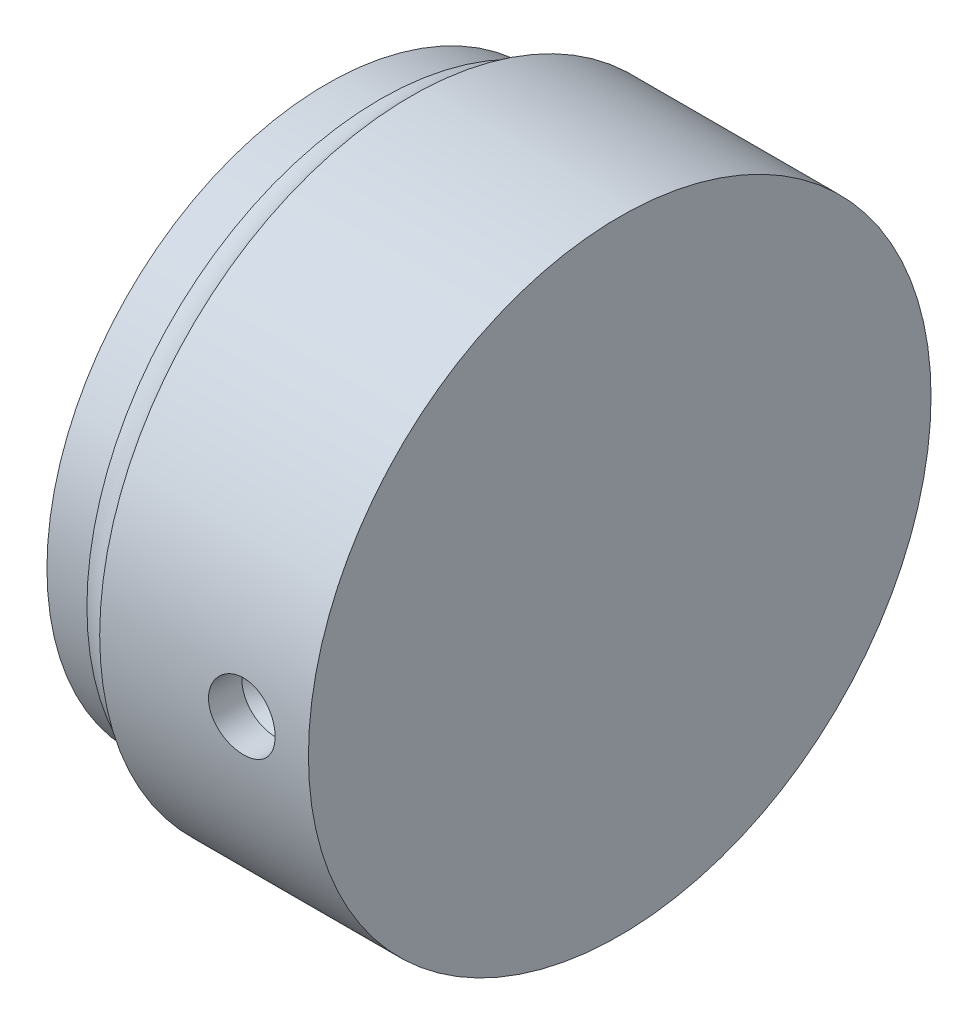
from build123d import *

# Parameters (mm, degrees)
CUT_EXTRUDE8_REACH      = 118.862
CUT_EXTRUDE8_END_RADIUS = 3
SKETCH2_R               = 2.5
SKETCH9_R               = 5
CUT_EXTRUDE9_DEPTH      = 5
CHAMFER1_SIZE           = 2.5


with BuildPart() as part:
    # Sketch1 → Revolve1 (revolve)
    with BuildSketch(Plane.XY, mode=Mode.PRIVATE) as revolve1_sk:
        with BuildLine():
            Line((-28.837765837, -3), (-15.779224455, -3))
            Line((-15.779224455, -3), (-15.779224455, 0))
            Line((-15.779224455, 0), (-8.279224455, 0))
            Line((-8.279224455, 0), (-8.279224455, -46.741129743))
            Line((-8.279224455, -46.741129743), (-39.621237636, -46.741129743))
            ThreePointArc((-39.621237636, -46.741129743), (-41.576881329, -44.736133736), (-44.279224455, -44))
            Line((-44.279224455, -44), (-44.279224455, -42))
            Line((-44.279224455, -42), (-52.279224455, -42))
            Line((-52.279224455, -42), (-52.279224455, -30))
            Line((-52.279224455, -30), (-52.279224455, -24.707456133))
            Line((-52.279224455, -24.707456133), (-50.558495146, -22.25))
            Line((-50.558495146, -22.25), (-50.558495146, -5.457456133))
            Line((-50.558495146, -5.457456133), (-48.837765837, -3))
            Line((-48.837765837, -3), (-28.837765837, -3))
        make_face()
    revolve(revolve1_sk.sketch.rotate(Axis((-82.123840877, 0, 0), (1, 0, 0)), 270), axis=Axis((-82.123840877, 0, 0), (1, 0, 0)))

    # Cut-Extrude8: up to this cylinder (the profile starts outside it)
    cut_extrude8_end = Plane(origin=(-18.279224, 0, 0), z_dir=(-1, 0, 0)) * Cylinder(CUT_EXTRUDE8_END_RADIUS, 244.724, mode=Mode.PRIVATE)
    # Sketch2 → Cut-Extrude8 (cut, up to the surface)
    with BuildSketch(Plane.XY.offset(46.741129743), mode=Mode.PRIVATE) as cut_extrude8_sk1:
        with Locations((-18.279224455, 0)):
            Circle(SKETCH2_R)
    cut_extrude8_tool1 = extrude(cut_extrude8_sk1.sketch, amount=-CUT_EXTRUDE8_REACH, mode=Mode.PRIVATE) - cut_extrude8_end
    add(cut_extrude8_tool1.solids().sort_by_distance((-18.279224, 0, 46.74113))[0], mode=Mode.SUBTRACT)

    # Sketch9 → Cut-Extrude9 (cut)
    with BuildSketch(Plane.XY.offset(46.741129743)):
        with Locations((-18.279224455, 0)):
            Circle(SKETCH9_R)
    extrude(amount=-CUT_EXTRUDE9_DEPTH, mode=Mode.SUBTRACT)

    # Chamfer1
    chamfer1_edges = [part.edges().sort_by_distance(p)[0] for p in [
        (-20.779224455, 0, 41.741129743),
    ]]
    chamfer(chamfer1_edges, length=CHAMFER1_SIZE - 0.0001)  # a hair under: the kernel refuses the full size


solid = part.part
